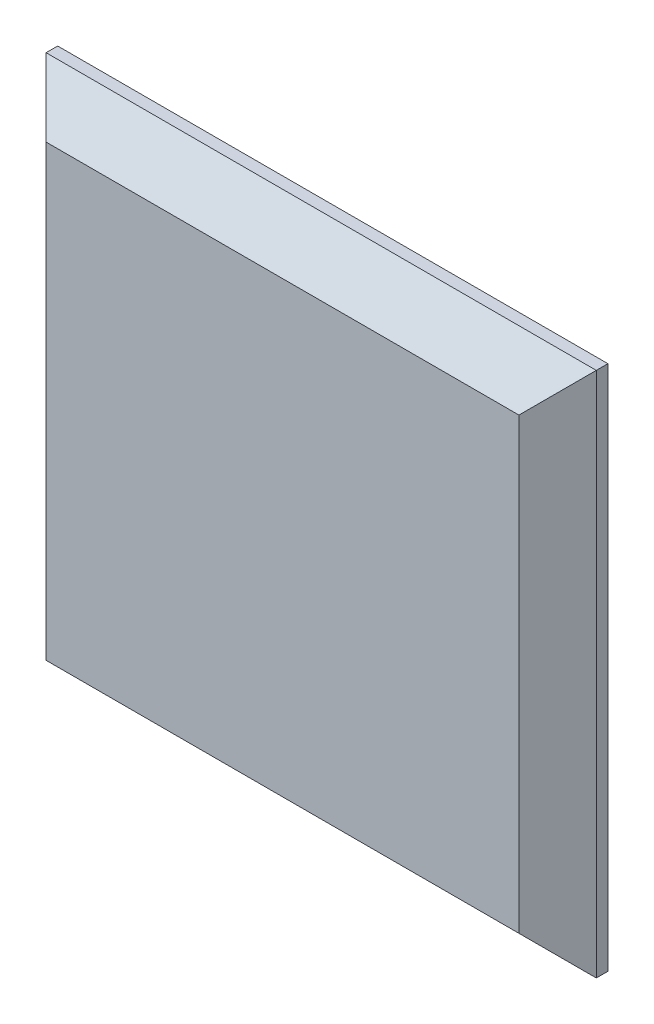
from build123d import *

# Parameters (mm, degrees)
SKETCH1_W           = 142.2
SKETCH1_H           = 136
BOSS_EXTRUDE1_DEPTH = 10
SKETCH2_W           = 142.2
SKETCH2_H           = 136
BOSS_EXTRUDE2_DEPTH = 3
CHAMFER1_SIZE       = 10
CHAMFER2_SIZE       = 8
SKETCH3_R           = 1.55
CUT_EXTRUDE1_DEPTH  = 2


with BuildPart() as part:
    # Sketch1 → Boss-Extrude1 (new body)
    with BuildSketch(Plane.XY):
        with Locations((-71.1, 68)):
            Rectangle(SKETCH1_W, SKETCH1_H)
        with BuildLine():
            ThreePointArc((-134.2, 5), (-135.078679656, 7.121320344), (-137.2, 8))
            Line((-137.2, 8), (-137.2, 128))
            ThreePointArc((-137.2, 128), (-135.078679656, 128.878679656), (-134.2, 131))
            Line((-134.2, 131), (-8, 131))
            ThreePointArc((-8, 131), (-7.121320344, 128.878679656), (-5, 128))
            Line((-5, 128), (-5, 8))
            ThreePointArc((-5, 8), (-7.121320344, 7.121320344), (-8, 5))
            Line((-8, 5), (-134.2, 5))
        make_face(mode=Mode.SUBTRACT)
    extrude(amount=BOSS_EXTRUDE1_DEPTH)

    # Sketch2 → Boss-Extrude2 (add)
    with BuildSketch(Plane.XY.offset(10)):
        with Locations((-71.1, 68)):
            Rectangle(SKETCH2_W, SKETCH2_H)
    extrude(amount=BOSS_EXTRUDE2_DEPTH)

    # Chamfer1
    chamfer1_edges = [part.edges().sort_by_distance(p)[0] for p in [
        (0, 68, 13),
        (-71.1, 136, 13),
        (-142.2, 68, 13),
        (-71.1, 0, 13),
    ]]
    chamfer(chamfer1_edges, length=CHAMFER1_SIZE)

    # Chamfer2
    chamfer2_edges = [part.edges().sort_by_distance(p)[0] for p in [
        (-71.1, 5, 10),
    ]]
    chamfer(chamfer2_edges, length=CHAMFER2_SIZE)
    chamfer2_2_edges = [part.edges().sort_by_distance(p)[0] for p in [
        (-137.2, 70.5, 10),
    ]]
    chamfer(chamfer2_2_edges, length=CHAMFER2_SIZE)
    chamfer2_3_edges = [part.edges().sort_by_distance(p)[0] for p in [
        (-68.6, 131, 10),
    ]]
    chamfer(chamfer2_3_edges, length=CHAMFER2_SIZE)
    chamfer2_4_edges = [part.edges().sort_by_distance(p)[0] for p in [
        (-5, 68, 10),
    ]]
    chamfer(chamfer2_4_edges, length=CHAMFER2_SIZE)

    # Sketch3 → Cut-Extrude1 (cut)
    with BuildSketch(Plane(origin=(0, 0, 0), x_dir=(-1, 0, 0), z_dir=(0, 0, -1))):
        with Locations((5, 5)):
            Circle(SKETCH3_R)
        with Locations((5, 131)):
            Circle(SKETCH3_R)
        with Locations((137.2, 5)):
            Circle(SKETCH3_R)
        with Locations((137.2, 131)):
            Circle(SKETCH3_R)
    extrude(amount=-CUT_EXTRUDE1_DEPTH, mode=Mode.SUBTRACT)


solid = part.part
